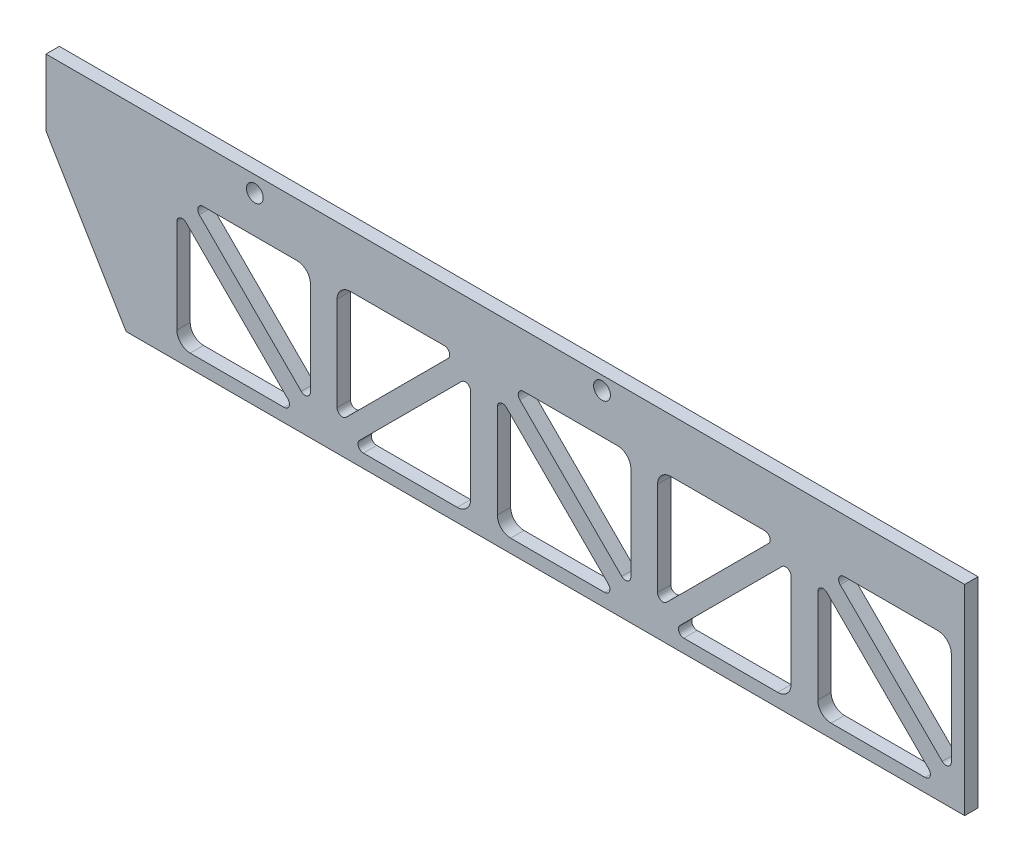
from build123d import *

# Parameters (mm, degrees)
MODEL_R             = 4
BOSS_EXTRUDE1_DEPTH = 6.35


with BuildPart() as part:
    # Model → Boss-Extrude1 (new body)
    with BuildSketch(Plane.XY):
        Polygon((-398.78, 0), (-436.88, 63.5), (-436.88, 95.25), (0, 95.25), (0, 0), align=None)
        with Locations((-172.466, 88.9)):
            Circle(MODEL_R, mode=Mode.SUBTRACT)
        with Locations((-337.566, 87.63)):
            Circle(MODEL_R, mode=Mode.SUBTRACT)
        with BuildLine():
            Line((-171.232102448, 6.35), (-215.9, 6.35))
            ThreePointArc((-215.9, 6.35), (-220.390128061, 8.209871939), (-222.25, 12.7))
            Line((-222.25, 12.7), (-222.25, 57.367897552))
            ThreePointArc((-222.25, 57.367897552), (-220.682015918, 59.714551564), (-217.913948776, 59.163948776))
            Line((-217.913948776, 59.163948776), (-169.436051224, 10.686051224))
            ThreePointArc((-169.436051224, 10.686051224), (-168.885448436, 7.917984082), (-171.232102448, 6.35))
        make_face(mode=Mode.SUBTRACT)
        with BuildLine():
            Line((-234.95, 57.367897552), (-234.95, 12.7))
            ThreePointArc((-234.95, 12.7), (-236.809871939, 8.209871939), (-241.3, 6.35))
            Line((-241.3, 6.35), (-285.967897552, 6.35))
            ThreePointArc((-285.967897552, 6.35), (-288.314551564, 7.917984082), (-287.763948776, 10.686051224))
            Line((-287.763948776, 10.686051224), (-239.286051224, 59.163948776))
            ThreePointArc((-239.286051224, 59.163948776), (-236.517984082, 59.714551564), (-234.95, 57.367897552))
        make_face(mode=Mode.SUBTRACT)
        with BuildLine():
            Line((-294.113948776, 17.036051224), (-245.636051224, 65.513948776))
            ThreePointArc((-245.636051224, 65.513948776), (-245.085448436, 68.282015918), (-247.432102448, 69.85))
            Line((-247.432102448, 69.85), (-292.1, 69.85))
            ThreePointArc((-292.1, 69.85), (-296.590128061, 67.990128061), (-298.45, 63.5))
            Line((-298.45, 63.5), (-298.45, 18.832102448))
            ThreePointArc((-298.45, 18.832102448), (-296.882015918, 16.485448436), (-294.113948776, 17.036051224))
        make_face(mode=Mode.SUBTRACT)
        with BuildLine():
            Line((-323.632102448, 6.35), (-368.3, 6.35))
            ThreePointArc((-368.3, 6.35), (-372.790128061, 8.209871939), (-374.65, 12.7))
            Line((-374.65, 12.7), (-374.65, 57.367897552))
            ThreePointArc((-374.65, 57.367897552), (-373.082015918, 59.714551564), (-370.313948776, 59.163948776))
            Line((-370.313948776, 59.163948776), (-321.836051224, 10.686051224))
            ThreePointArc((-321.836051224, 10.686051224), (-321.285448436, 7.917984082), (-323.632102448, 6.35))
        make_face(mode=Mode.SUBTRACT)
        with BuildLine():
            Line((-18.832102448, 6.35), (-63.5, 6.35))
            ThreePointArc((-63.5, 6.35), (-67.990128061, 8.209871939), (-69.85, 12.7))
            Line((-69.85, 12.7), (-69.85, 57.367897552))
            ThreePointArc((-69.85, 57.367897552), (-68.282015918, 59.714551564), (-65.513948776, 59.163948776))
            Line((-65.513948776, 59.163948776), (-17.036051224, 10.686051224))
            ThreePointArc((-17.036051224, 10.686051224), (-16.485448436, 7.917984082), (-18.832102448, 6.35))
        make_face(mode=Mode.SUBTRACT)
        with BuildLine():
            Line((-82.55, 57.367897552), (-82.55, 12.7))
            ThreePointArc((-82.55, 12.7), (-84.409871939, 8.209871939), (-88.9, 6.35))
            Line((-88.9, 6.35), (-133.567897552, 6.35))
            ThreePointArc((-133.567897552, 6.35), (-135.914551564, 7.917984082), (-135.363948776, 10.686051224))
            Line((-135.363948776, 10.686051224), (-86.886051224, 59.163948776))
            ThreePointArc((-86.886051224, 59.163948776), (-84.117984082, 59.714551564), (-82.55, 57.367897552))
        make_face(mode=Mode.SUBTRACT)
        with BuildLine():
            Line((-93.236051224, 65.513948776), (-141.713948776, 17.036051224))
            ThreePointArc((-141.713948776, 17.036051224), (-144.482015918, 16.485448436), (-146.05, 18.832102448))
            Line((-146.05, 18.832102448), (-146.05, 63.5))
            ThreePointArc((-146.05, 63.5), (-144.190128061, 67.990128061), (-139.7, 69.85))
            Line((-139.7, 69.85), (-95.032102448, 69.85))
            ThreePointArc((-95.032102448, 69.85), (-92.685448436, 68.282015918), (-93.236051224, 65.513948776))
        make_face(mode=Mode.SUBTRACT)
        with BuildLine():
            Line((-163.086051224, 17.036051224), (-211.563948776, 65.513948776))
            ThreePointArc((-211.563948776, 65.513948776), (-212.114551564, 68.282015918), (-209.767897552, 69.85))
            Line((-209.767897552, 69.85), (-165.1, 69.85))
            ThreePointArc((-165.1, 69.85), (-160.609871939, 67.990128061), (-158.75, 63.5))
            Line((-158.75, 63.5), (-158.75, 18.832102448))
            ThreePointArc((-158.75, 18.832102448), (-160.317984082, 16.485448436), (-163.086051224, 17.036051224))
        make_face(mode=Mode.SUBTRACT)
        with BuildLine():
            Line((-315.486051224, 17.036051224), (-363.963948776, 65.513948776))
            ThreePointArc((-363.963948776, 65.513948776), (-364.514551564, 68.282015918), (-362.167897552, 69.85))
            Line((-362.167897552, 69.85), (-317.5, 69.85))
            ThreePointArc((-317.5, 69.85), (-313.009871939, 67.990128061), (-311.15, 63.5))
            Line((-311.15, 63.5), (-311.15, 18.832102448))
            ThreePointArc((-311.15, 18.832102448), (-312.717984082, 16.485448436), (-315.486051224, 17.036051224))
        make_face(mode=Mode.SUBTRACT)
        with BuildLine():
            Line((-6.35, 63.5), (-6.35, 18.832102448))
            ThreePointArc((-6.35, 18.832102448), (-7.917984082, 16.485448436), (-10.686051224, 17.036051224))
            Line((-10.686051224, 17.036051224), (-59.163948776, 65.513948776))
            ThreePointArc((-59.163948776, 65.513948776), (-59.714551564, 68.282015918), (-57.367897552, 69.85))
            Line((-57.367897552, 69.85), (-12.7, 69.85))
            ThreePointArc((-12.7, 69.85), (-8.209871939, 67.990128061), (-6.35, 63.5))
        make_face(mode=Mode.SUBTRACT)
    extrude(amount=BOSS_EXTRUDE1_DEPTH)


solid = part.part
